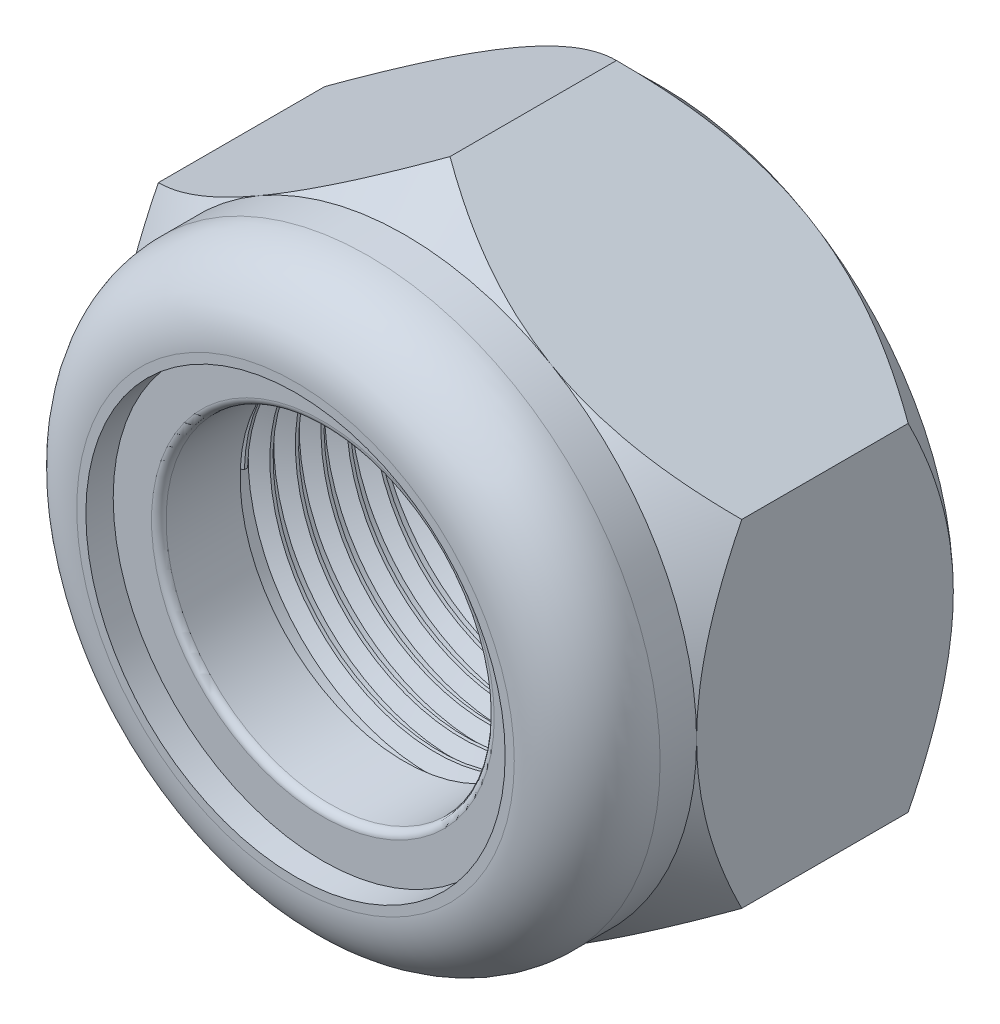
from build123d import *

# Parameters (mm, degrees)
SKETCH1_R                = 2.5
BOSS_EXTRUDE1_DEPTH      = 1.76
SKETCH3_OUTSIDE_W        = 19.584
SKETCH3_OUTSIDE_H        = 20.822
SKETCH3_OUTSIDE_R        = 4.000001462438346
CUT_EXTRUDE4_DEPTH       = 3.52
CUT_EXTRUDE4_DRAFT       = -45.0000000000001
MIRROR1_COPY_1_SKETCH_W  = 19.584
MIRROR1_COPY_1_SKETCH_H  = 20.822
MIRROR1_COPY_1_SKETCH_R  = 4.000001462438346
MIRROR1_COPY_1_DEPTH     = 3.52
MIRROR1_COPY_1_DRAFT     = -45.0000000000001
SKETCH4_R                = 2.875
BOSS_EXTRUDE2_DEPTH      = 1.5
FILLET1_R                = 1
THREAD1_PITCH            = 0.35
BOSS_EXTRUDE3_DEPTH      = 0.375
BOSS_EXTRUDE3_DEPTH_BACK = 0.74
SKETCH5_R                = 2.875
SKETCH5_R_2              = 2.25
FILLET2_R                = 0.1


with BuildPart() as part:
    # Sketch1 → Boss-Extrude1 (new, symmetric)
    with BuildSketch(Plane.XY):
        Polygon((1.3e-15, -4.618802153517007), (4, -2.3094010767585034), (3.9999999999999982, 2.3094010767585047), (-1.72e-15, 4.618802153517007), (-4.000000000000002, 2.309401076758502), (-4, -2.309401076758504), align=None)
        Circle(SKETCH1_R, mode=Mode.SUBTRACT)
    extrude(amount=BOSS_EXTRUDE1_DEPTH, both=True)


with BuildPart() as cut_extrude4_tool:
    # Sketch3 outside → Cut-Extrude4 (with draft: the straight prism first)
    with BuildSketch(Plane.XY.offset(1.76)):
        Rectangle(SKETCH3_OUTSIDE_W, SKETCH3_OUTSIDE_H)
        Circle(SKETCH3_OUTSIDE_R, mode=Mode.SUBTRACT)
    extrude(amount=-CUT_EXTRUDE4_DEPTH)
    # Cut-Extrude4: the draft: its side faces are tilted about the plane it starts from
    cut_extrude4_sides = [cut_extrude4_tool.faces().sort_by_distance(p)[0] for p in [
        (0, -10.411, 0),
        (9.792, 0, 0),
        (0, 10.411, 0),
        (-9.792, 0, 0),
        (-4.000001462, 0, 0),
    ]]
    draft(cut_extrude4_sides, Plane.XY.offset(1.76), CUT_EXTRUDE4_DRAFT)


with BuildPart() as part_1:
    add(part.part)

    # Cut-Extrude4: cut by cut_extrude4_tool
    add(cut_extrude4_tool.part, mode=Mode.SUBTRACT)


with BuildPart() as mirror1_copy_1_tool:
    # Mirror1 copy 1 sketch → Mirror1 copy 1 (with draft: the straight prism first)
    with BuildSketch(Plane(origin=(0, 0, -1.76), x_dir=(1, 0, 0), z_dir=(0, 0, -1))):
        Rectangle(MIRROR1_COPY_1_SKETCH_W, MIRROR1_COPY_1_SKETCH_H)
        Circle(MIRROR1_COPY_1_SKETCH_R, mode=Mode.SUBTRACT)
    extrude(amount=-MIRROR1_COPY_1_DEPTH)
    # Mirror1 copy 1: the draft: its side faces are tilted about the plane it starts from
    mirror1_copy_1_sides = [mirror1_copy_1_tool.faces().sort_by_distance(p)[0] for p in [
        (0, -10.411, 0),
        (9.792, 0, 0),
        (0, 10.411, 0),
        (-9.792, 0, 0),
        (-4.000001462, 0, 0),
    ]]
    draft(mirror1_copy_1_sides, Plane(origin=(0, 0, -1.76), x_dir=(1, 0, 0), z_dir=(0, 0, -1)), MIRROR1_COPY_1_DRAFT)


with BuildPart() as part_2:
    add(part_1.part)

    # Mirror1 copy 1: cut by mirror1_copy_1_tool
    add(mirror1_copy_1_tool.part, mode=Mode.SUBTRACT)

    # Sketch4 → Boss-Extrude2 (add)
    with BuildSketch(Plane.XY.offset(1.76)):
        with BuildLine():
            ThreePointArc((2.0000000000000004, -3.4641016151377544), (3.464101615137755, -1.9999999999999998), (4, 0))
            ThreePointArc((4, 0), (3.4641016151377544, 2), (1.9999999999999996, 3.464101615137755))
            ThreePointArc((1.9999999999999996, 3.464101615137755), (-6.4e-16, 4), (-2.000000000000001, 3.4641016151377544))
            ThreePointArc((-2.000000000000001, 3.4641016151377544), (-3.464101615137755, 1.9999999999999998), (-4, -1.29e-15))
            ThreePointArc((-4, -1.29e-15), (-3.464101615137754, -2.0000000000000013), (-1.9999999999999982, -3.4641016151377553))
            ThreePointArc((-1.9999999999999982, -3.4641016151377553), (2.02e-15, -3.9999999999999996), (2.0000000000000004, -3.4641016151377544))
        make_face()
        Circle(SKETCH4_R, mode=Mode.SUBTRACT)
    extrude(amount=BOSS_EXTRUDE2_DEPTH)

    # Fillet1
    fillet1_edges = [part_2.edges().sort_by_distance(p)[0] for p in [
        (2, -3.4641016151377766, 3.26),
    ]]
    fillet(fillet1_edges, radius=FILLET1_R)

    # Thread1: the profile of Thread Profile1 profile screwed along a right-hand helix of 9.142857 turns, 6 arcs to a turn; built about Z, then put on its axis
    thread1_z = Axis((0, 0, 0), (0, 0, 1))
    thread1_corners = [(2.5003, 0, 0.262673206), (2.310556942, 0, 0.153125001), (2.310556942, 0, 0.109375001), (2.5003, 0, -0.000173205)]
    with BuildLine(mode=Mode.PRIVATE) as thread1_profile:
        Line(thread1_corners[0], thread1_corners[1])
        Line(thread1_corners[1], thread1_corners[2])
        Line(thread1_corners[2], thread1_corners[3])
        Line(thread1_corners[3], thread1_corners[0])
    thread1_cap = Face(thread1_profile.wire())
    thread1_turn_angles = [0, 30, 60, 90, 120, 150, 180, 210, 240, 270, 300, 330, 360]
    thread1_turn_weights = [1, 0.8660254037844387, 1, 0.8660254037844387, 1, 0.8660254037844387, 1, 0.8660254037844387, 1, 0.8660254037844387, 1, 0.8660254037844387, 1]
    thread1_turn_rails = [Edge.make_bspline([Vector(p[0], p[1], 0).rotate(thread1_z, thread1_turn_angles[k]) / thread1_turn_weights[k] + Vector(0, 0, p[2] + THREAD1_PITCH * thread1_turn_angles[k] / 360) for k in range(13)], [0, 0, 0, 1, 1, 2, 2, 3, 3, 4, 4, 5, 5, 6, 6, 6], 2, thread1_turn_weights) for p in thread1_corners]
    thread1_turn_sides = [Face.make_surface_from_curves(thread1_turn_rails[p[0]], thread1_turn_rails[p[1]]) for p in [(0, 1), (1, 2), (2, 3), (3, 0)]]
    thread1_last_angles = [3240, 3265.714285714, 3291.428571429]
    thread1_last_weights = [1, 0.9009688679024186, 1]
    thread1_last_rails = [Edge.make_bspline([Vector(p[0], p[1], 0).rotate(thread1_z, thread1_last_angles[k]) / thread1_last_weights[k] + Vector(0, 0, p[2] + THREAD1_PITCH * thread1_last_angles[k] / 360) for k in range(3)], [0, 0, 0, 1, 1, 1], 2, thread1_last_weights) for p in thread1_corners]
    thread1_last_sides = [Face.make_surface_from_curves(thread1_last_rails[p[0]], thread1_last_rails[p[1]]) for p in [(0, 1), (1, 2), (2, 3), (3, 0)]]
    thread1 = Plane(origin=(0, 0, 1.76), x_dir=(-1, 0, 0), z_dir=(0, 0, -1)) * Solid(Shell([*[p.moved(Location((0, 0, THREAD1_PITCH * i))) for i in range(9) for p in thread1_turn_sides], *thread1_last_sides, thread1_cap, thread1_cap.rotate(thread1_z, 3291.428571429).moved(Location((0, 0, THREAD1_PITCH * 3291.428571429 / 360)))]))
    add(thread1)

    # Sketch5 → Boss-Extrude3 (add, two sides: drawn at the far end of the back side and taken through both)
    with BuildSketch(Plane.XY.offset(2.5100000000000002).offset(-BOSS_EXTRUDE3_DEPTH_BACK)):
        Circle(SKETCH5_R)
        Circle(SKETCH5_R_2, mode=Mode.SUBTRACT)
    extrude(amount=BOSS_EXTRUDE3_DEPTH + BOSS_EXTRUDE3_DEPTH_BACK)

    # Fillet2
    fillet2_edges = [part_2.edges().sort_by_distance(p)[0] for p in [
        (-2.25, 2.8e-16, 2.8850000000000002),
    ]]
    fillet(fillet2_edges, radius=FILLET2_R)


solid = part_2.part
